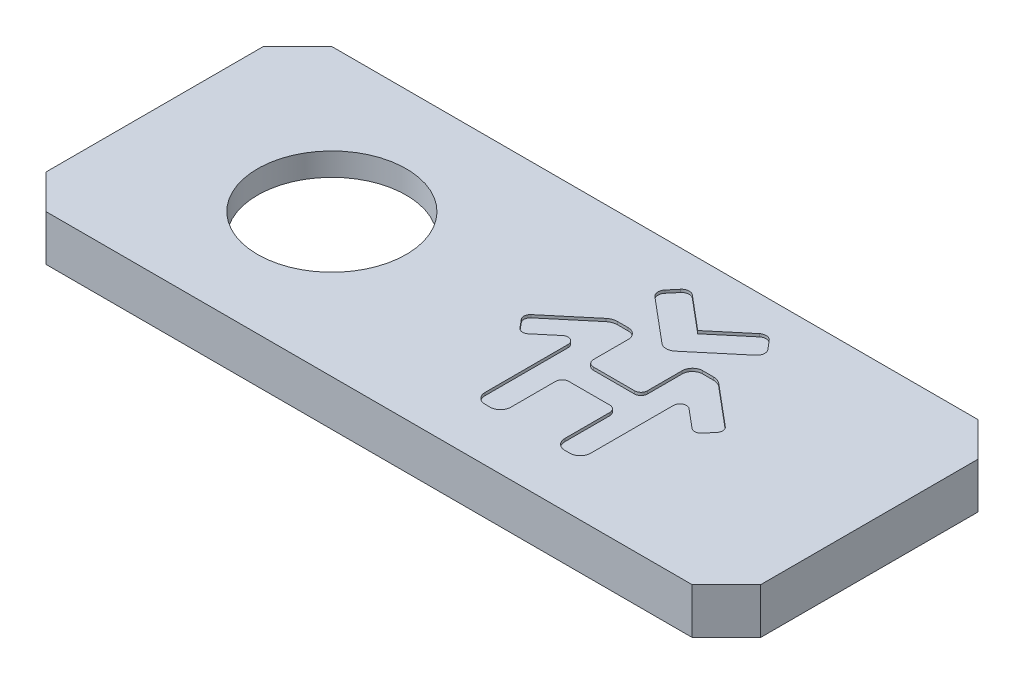
from build123d import *

# Parameters (mm, degrees)
SKETCH_1_R          = 1.45
EXTRUDE_1_DEPTH     = 2
EXTRUDE_2_DEPTH     = 2
SKETCH_3_R          = 6.5
CUT_EXTRUDE_1_DEPTH = 2
SKETCH_4_R          = 1.45
CUT_EXTRUDE_2_DEPTH = 1
CUT_EXTRUDE_3_DEPTH = 0.25


with BuildPart() as part:
    # Эскиз1 → Бобышка-Вытянуть1 (new body)
    with BuildSketch(Plane(origin=(0, 0, 0), x_dir=(1, 0, 0), z_dir=(0, 1, 0))):
        Polygon((35.593108597, -12.265362584), (35.593108597, 6.734637416), (32.593108597, 9.734637416), (-23.906891403, 9.734637416), (-26.906891403, 6.734637416), (-26.906891403, -12.265362584), (-23.906891403, -15.265362584), (32.593108597, -15.265362584), align=None)
        with Locations((-22.906891403, -11.765362584)):
            Circle(SKETCH_1_R, mode=Mode.SUBTRACT)
        with BuildLine():
            Line((25.893108597, 8.234637416), (-15.606891403, 8.234637416))
            Line((-15.606891403, 8.234637416), (-24.906891403, 2.234637416))
            Line((-24.906891403, 2.234637416), (-24.906891403, -8.765362584))
            Line((-24.906891403, -8.765362584), (-15.008932433, -13.765362584))
            Line((-15.008932433, -13.765362584), (26.491067567, -13.765362584))
            Line((26.491067567, -13.765362584), (33.593108597, -10.265362584))
            Line((33.593108597, -10.265362584), (33.593108597, 4.734637416))
            Line((33.593108597, 4.734637416), (32.596332637, 5.187717397))
            ThreePointArc((32.596332637, 5.187717397), (32.193122866, 7.554668808), (30.144679077, 6.302105379))
            Line((30.144679077, 6.302105379), (25.893108597, 8.234637416))
        make_face(mode=Mode.SUBTRACT)
    extrude(amount=EXTRUDE_1_DEPTH)

    # Эскиз2 → Бобышка-Вытянуть2 (add)
    with BuildSketch(Plane(origin=(0, 2, 0), x_dir=(1, 0, 0), z_dir=(0, 1, 0))):
        Polygon((32.593108597, -15.265362584), (35.593108597, -12.265362584), (35.593108597, 6.734637416), (32.593108597, 9.734637416), (-23.906891403, 9.734637416), (-26.906891403, 6.734637416), (-26.906891403, -12.265362584), (-23.906891403, -15.265362584), align=None)
    extrude(amount=EXTRUDE_2_DEPTH)

    # Эскиз3 → Вырез-Вытянуть1 (cut)
    with BuildSketch(Plane(origin=(0, 4, 0), x_dir=(1, 0, 0), z_dir=(0, 1, 0))):
        with Locations((-11.406891403, -2.765362584)):
            Circle(SKETCH_3_R)
    extrude(amount=-CUT_EXTRUDE_1_DEPTH, mode=Mode.SUBTRACT)

    # Эскиз4 → Вырез-Вытянуть2 (cut)
    with BuildSketch(Plane.XZ.offset(-2)):
        with Locations((31.593108597, -6.234637416)):
            Circle(SKETCH_4_R)
        with Locations((-22.906891403, 11.765362584)):
            Circle(SKETCH_4_R)
    extrude(amount=-CUT_EXTRUDE_2_DEPTH, mode=Mode.SUBTRACT)

    # Эскиз5 → Вырез-Вытянуть3 (cut)
    with BuildSketch(Plane(origin=(0, 4, 0), x_dir=(1, 0, 0), z_dir=(0, 1, 0))):
        with BuildLine():
            Line((8.980608597, -2.500998747), (8.980608597, -9.758351134))
            ThreePointArc((8.980608597, -9.758351134), (9.244212494, -10.394747237), (9.880608597, -10.658351134))
            Line((9.880608597, -10.658351134), (10.330608597, -10.658351134))
            ThreePointArc((10.330608597, -10.658351134), (10.9670047, -10.394747237), (11.230608597, -9.758351134))
            Line((11.230608597, -9.758351134), (11.230608597, -5.827862584))
            ThreePointArc((11.230608597, -5.827862584), (11.395361032, -5.43011502), (11.793108597, -5.265362584))
            Line((11.793108597, -5.265362584), (15.393108597, -5.265362584))
            ThreePointArc((15.393108597, -5.265362584), (15.790856161, -5.43011502), (15.955608597, -5.827862584))
            Line((15.955608597, -5.827862584), (15.955608597, -9.758351134))
            ThreePointArc((15.955608597, -9.758351134), (16.219212494, -10.394747237), (16.855608597, -10.658351134))
            Line((16.855608597, -10.658351134), (17.305608597, -10.658351134))
            ThreePointArc((17.305608597, -10.658351134), (17.9420047, -10.394747237), (18.205608597, -9.758351134))
            Line((18.205608597, -9.758351134), (18.205608597, -2.500998747))
            ThreePointArc((18.205608597, -2.500998747), (18.530385824, -1.991200617), (19.129676627, -2.070098747))
            Line((19.129676627, -2.070098747), (20.756009257, -3.434753858))
            ThreePointArc((20.756009257, -3.434753858), (21.166602393, -3.564213376), (21.548477287, -3.365421889))
            Line((21.548477287, -3.365421889), (22.153040559, -2.644931438))
            ThreePointArc((22.153040559, -2.644931438), (22.282500077, -2.234338302), (22.08370859, -1.852463408))
            Line((22.08370859, -1.852463408), (18.519278144, 1.138448864))
            ThreePointArc((18.519278144, 1.138448864), (18.180914744, 1.333803064), (17.796142083, 1.401648866))
            Line((17.796142083, 1.401648866), (16.855608597, 1.401648866))
            ThreePointArc((16.855608597, 1.401648866), (16.219212494, 1.138044969), (15.955608597, 0.501648866))
            Line((15.955608597, 0.501648866), (15.955608597, -2.535851134))
            ThreePointArc((15.955608597, -2.535851134), (15.790856161, -2.933598699), (15.393108597, -3.098351134))
            Line((15.393108597, -3.098351134), (11.793108597, -3.098351134))
            ThreePointArc((11.793108597, -3.098351134), (11.395361032, -2.933598699), (11.230608597, -2.535851134))
            Line((11.230608597, -2.535851134), (11.230608597, 0.501648866))
            ThreePointArc((11.230608597, 0.501648866), (10.9670047, 1.138044969), (10.330608597, 1.401648866))
            Line((10.330608597, 1.401648866), (9.39007511, 1.401648866))
            ThreePointArc((9.39007511, 1.401648866), (9.005302449, 1.333803064), (8.666939049, 1.138448864))
            Line((8.666939049, 1.138448864), (5.102508603, -1.852463408))
            ThreePointArc((5.102508603, -1.852463408), (4.903717116, -2.234338302), (5.033176634, -2.644931438))
            Line((5.033176634, -2.644931438), (5.637739906, -3.365421889))
            ThreePointArc((5.637739906, -3.365421889), (6.0196148, -3.564213376), (6.430207936, -3.434753858))
            Line((6.430207936, -3.434753858), (8.056540566, -2.070098747))
            ThreePointArc((8.056540566, -2.070098747), (8.655831369, -1.991200617), (8.980608597, -2.500998747))
        make_face()
        with BuildLine():
            Line((13.593108597, 4.226315266), (10.66501019, 6.683281559))
            ThreePointArc((10.66501019, 6.683281559), (10.172298427, 6.838632981), (9.714048554, 6.600083196))
            Line((9.714048554, 6.600083196), (9.08803108, 5.854024623))
            ThreePointArc((9.08803108, 5.854024623), (8.932679658, 5.36131286), (9.171229443, 4.903062987))
            Line((9.171229443, 4.903062987), (13.014599748, 1.678092382))
            ThreePointArc((13.014599748, 1.678092382), (13.593108597, 1.467532381), (14.171617445, 1.678092382))
            Line((14.171617445, 1.678092382), (18.01498775, 4.903062987))
            ThreePointArc((18.01498775, 4.903062987), (18.253537535, 5.36131286), (18.098186113, 5.854024623))
            Line((18.098186113, 5.854024623), (17.472168639, 6.600083196))
            ThreePointArc((17.472168639, 6.600083196), (17.013918766, 6.838632981), (16.521207003, 6.683281559))
            Line((16.521207003, 6.683281559), (13.593108597, 4.226315266))
        make_face()
    extrude(amount=-CUT_EXTRUDE_3_DEPTH, mode=Mode.SUBTRACT)


solid = part.part
